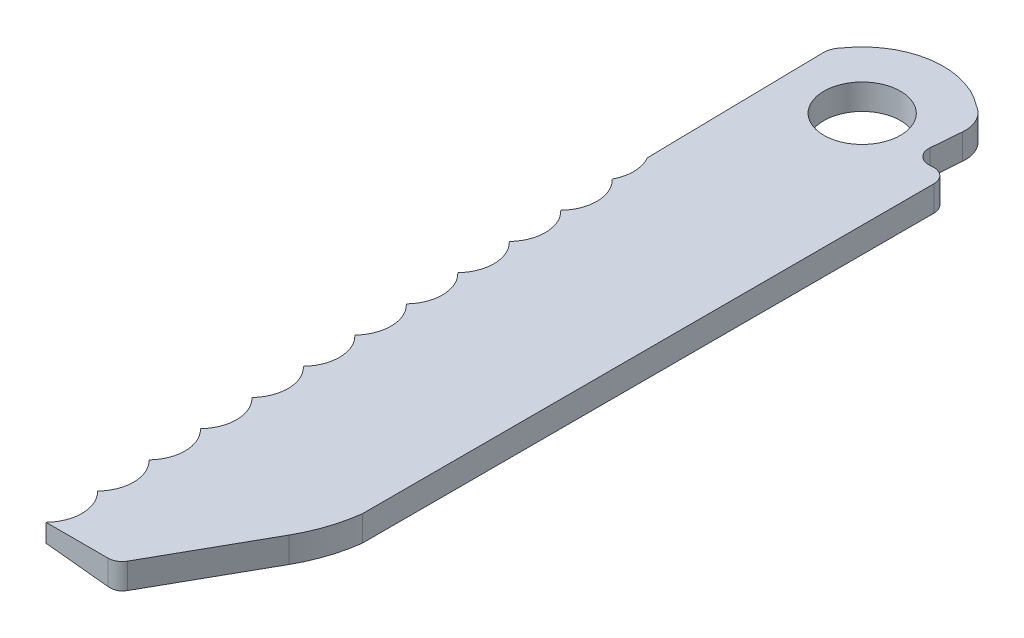
from build123d import *

# Parameters (mm, degrees)
SKETCH1_R           = 2.0955
BOSS_EXTRUDE1_DEPTH = 1.397
CUT_EXTRUDE1_DEPTH  = 52.451
FILLET1_R           = 0.762


with BuildPart() as part:
    # Sketch1 → Boss-Extrude1 (new body)
    with BuildSketch(Plane(origin=(0, 0, 0), x_dir=(1, 0, 0), z_dir=(0, 1, 0))):
        with BuildLine():
            Line((58.55952583, 61.258221204), (58.353154756, 58.740839189))
            Line((58.353154756, 58.740839189), (60.233523586, 58.806978547))
            Line((60.233523586, 58.806978547), (60.233523586, 26.737280478))
            ThreePointArc((60.233523586, 26.737280478), (59.880256289, 25.172884165), (59.23233006, 23.70580366))
            Line((59.23233006, 23.70580366), (55.832701645, 17.667514202))
            Line((55.832701645, 17.667514202), (51.983016908, 17.667514202))
            ThreePointArc((51.983016908, 17.667514202), (52.547906247, 19.125917757), (51.912761054, 20.555124348))
            ThreePointArc((51.912761054, 20.555124348), (52.477650393, 22.013527903), (51.8425052, 23.442734493))
            ThreePointArc((51.8425052, 23.442734493), (52.407394539, 24.901138048), (51.772249345, 26.330344639))
            ThreePointArc((51.772249345, 26.330344639), (52.337138685, 27.788748194), (51.701993491, 29.217954785))
            ThreePointArc((51.701993491, 29.217954785), (52.26688283, 30.67635834), (51.631737637, 32.105564931))
            ThreePointArc((51.631737637, 32.105564931), (52.196626976, 33.563968486), (51.561481783, 34.993175076))
            ThreePointArc((51.561481783, 34.993175076), (52.126371122, 36.451578631), (51.491225929, 37.880785222))
            ThreePointArc((51.491225929, 37.880785222), (52.056115268, 39.339188777), (51.420970074, 40.768395368))
            ThreePointArc((51.420970074, 40.768395368), (51.985859414, 42.226798923), (51.35071422, 43.656005513))
            ThreePointArc((51.35071422, 43.656005513), (51.915603559, 45.114409069), (51.280458366, 46.543615659))
            ThreePointArc((51.280458366, 46.543615659), (51.845347705, 48.002019214), (51.210202512, 49.431225805))
            ThreePointArc((51.210202512, 49.431225805), (51.440169923, 50.422333219), (51.16227565, 51.401084305))
            Line((51.16227565, 51.401084305), (50.990790202, 61.172939676))
            ThreePointArc((50.990790202, 61.172939676), (51.066339779, 61.593364819), (51.296307316, 61.953337))
            ThreePointArc((51.296307316, 61.953337), (54.294129545, 63.790707746), (57.689144841, 62.875972532))
            ThreePointArc((57.689144841, 62.875972532), (58.363686749, 62.195872482), (58.55952583, 61.258221204))
        make_face()
        with Locations((54.929222866, 59.390217764)):
            Circle(SKETCH1_R, mode=Mode.SUBTRACT)
    extrude(amount=BOSS_EXTRUDE1_DEPTH)

    # Sketch2 → Cut-Extrude1 (cut)
    with BuildSketch(Plane.XY):
        Polygon((55.832701645, 0), (50.990790202, 0.508905399), (50.990790202, 0), align=None)
    extrude(amount=-CUT_EXTRUDE1_DEPTH, mode=Mode.SUBTRACT)

    # Fillet1
    fillet1_edges = [part.edges().sort_by_distance(p)[0] for p in [
        (60.233523586, 0.6985, -58.806978547),
        (58.353154756, 0.6985, -58.740839189),
        (55.832701645, 0.6985, -17.667514202),
    ]]
    fillet(fillet1_edges, radius=FILLET1_R)


solid = part.part
